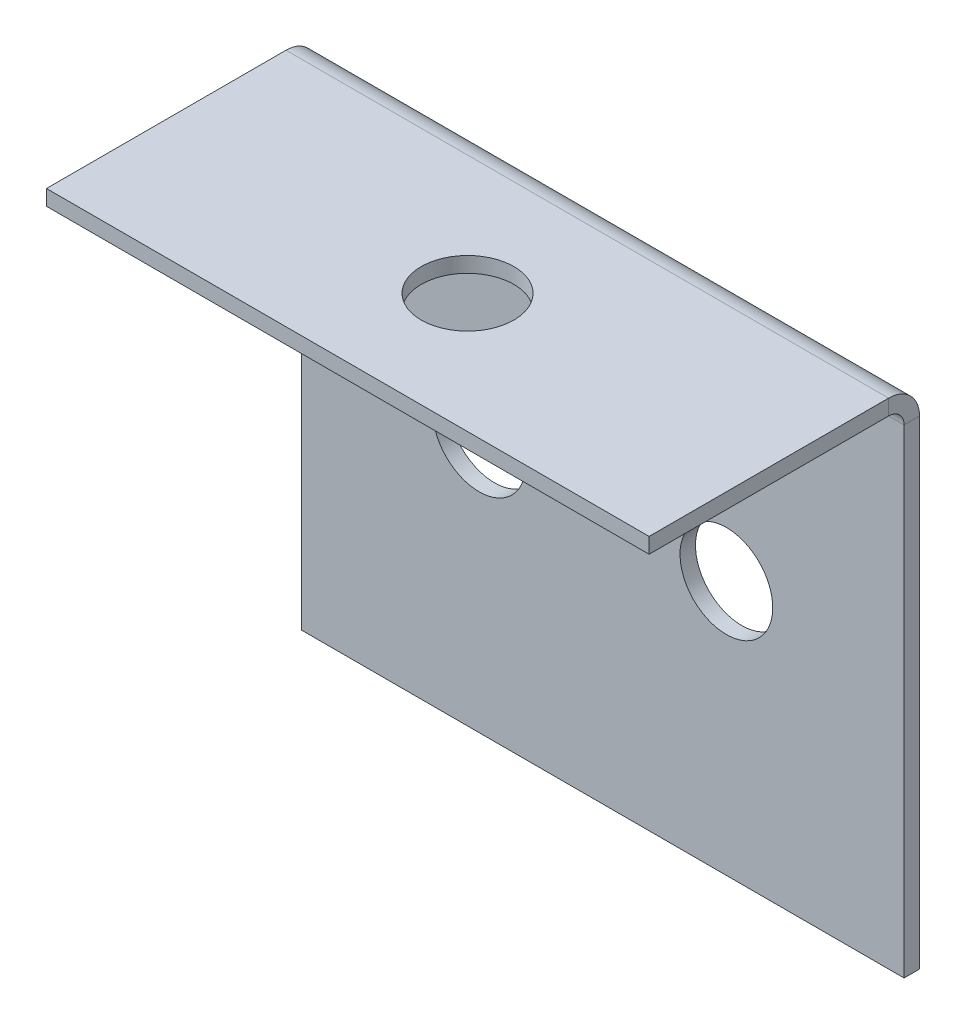
from build123d import *

# Parameters (mm, degrees)
BRIDA_BASE1_DEPTH     = 19.5
CROQUIS9_R            = 1.5
CORTAR_EXTRUIR4_DEPTH = 0.5
CROQUIS10_R           = 1.5
CORTAR_EXTRUIR5_DEPTH = 0.5


# Sheet-metal steps are written as plain solids
with BuildPart() as part:
    # Croquis1 → Brida base1 (new body)
    with BuildSketch(Plane(origin=(0, 0, 0), x_dir=(0, 0, -1), z_dir=(1, 0, 0))):
        with BuildLine():
            Line((-8.25, 24.950879865), (-0.5, 24.950879865))
            ThreePointArc((-0.5, 24.950879865), (-0.146446609, 24.804433255), (0, 24.450879865))
            Line((0, 24.450879865), (0, 8.950879865))
            Line((0, 8.950879865), (0.5, 8.950879865))
            Line((0.5, 8.950879865), (0.5, 24.450879865))
            ThreePointArc((0.5, 24.450879865), (0.207106781, 25.157986646), (-0.5, 25.450879865))
            Line((-0.5, 25.450879865), (-8.25, 25.450879865))
            Line((-8.25, 25.450879865), (-8.25, 24.950879865))
        make_face()
    extrude(amount=BRIDA_BASE1_DEPTH)

    # Croquis9 → Cortar-Extruir4 (cut)
    with BuildSketch(Plane(origin=(0, 0, -0.5), x_dir=(-1, 0, 0), z_dir=(0, 0, -1))):
        with Locations(Location((-13.75, 17.200879865, 0), (0, 0, 90))):
            Circle(CROQUIS9_R)
        with Locations(Location((-5.75, 17.200879865, 0), (0, 0, 90))):
            Circle(CROQUIS9_R)
    extrude(amount=-CORTAR_EXTRUIR4_DEPTH, mode=Mode.SUBTRACT)

    # Croquis10 → Cortar-Extruir5 (cut)
    with BuildSketch(Plane(origin=(0, 25.450879865, 0), x_dir=(1, 0, 0), z_dir=(0, 1, 0))):
        with Locations(Location((9.75, -4.375, 0), (0, 0, 270))):
            Circle(CROQUIS10_R)
    extrude(amount=-CORTAR_EXTRUIR5_DEPTH, mode=Mode.SUBTRACT)


solid = part.part
